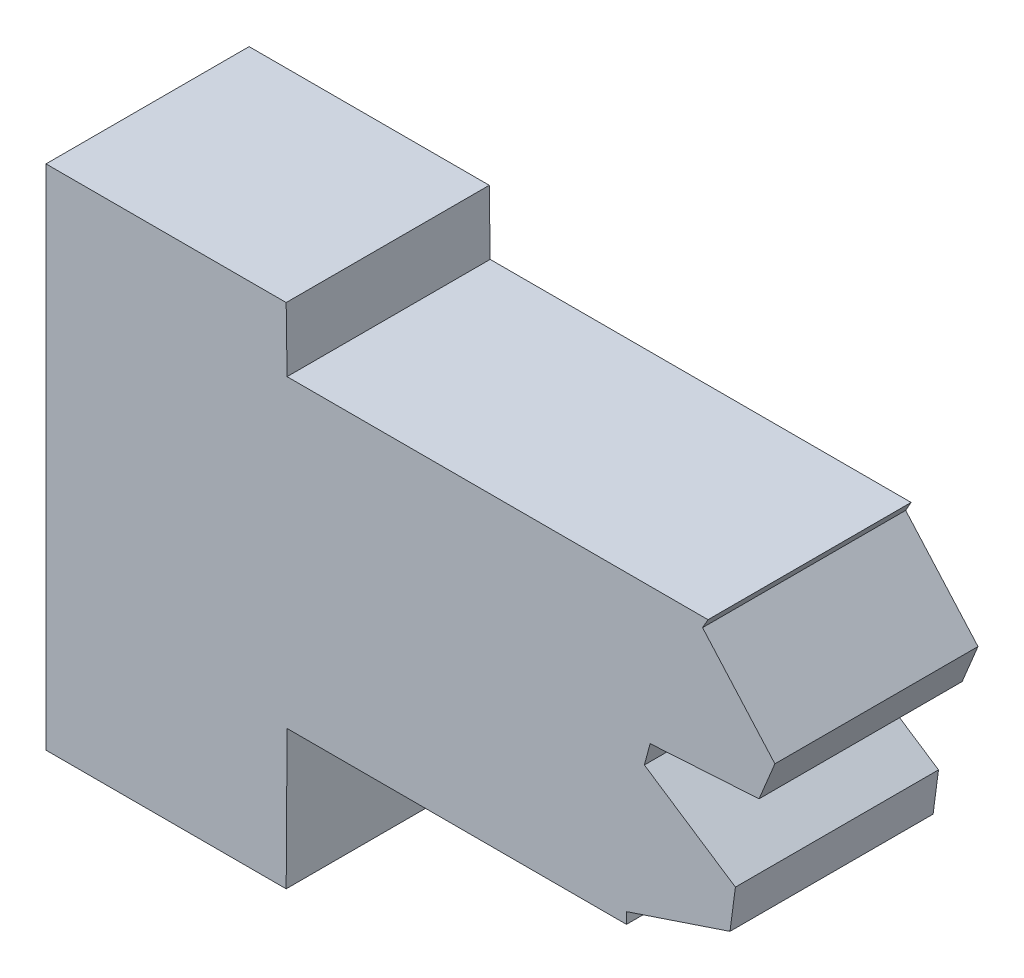
from build123d import *

# Parameters (mm, degrees)
BOSS_EXTRUDE1_DEPTH = 4


with BuildPart() as part:
    # Sketch1 → Boss-Extrude1 (new body)
    with BuildSketch(Plane.XY):
        Polygon((4.747783705, 2.744764558), (11.432074911, 2.744764558), (11.432074911, 2.962852563), (13.470675328, 3.644764558), (13.577097115, 4.453118281), (11.784452134, 5.639423302), (11.897342793, 6.060736975), (14.042971396, 6.191784769), (14.354984287, 6.945050522), (12.930460535, 8.554903841), (13.037783705, 8.744756719), (4.747783705, 8.744756719), (4.73, 10), (0, 10), (0, 0), (4.73, 0), align=None)
    extrude(amount=BOSS_EXTRUDE1_DEPTH)


solid = part.part
